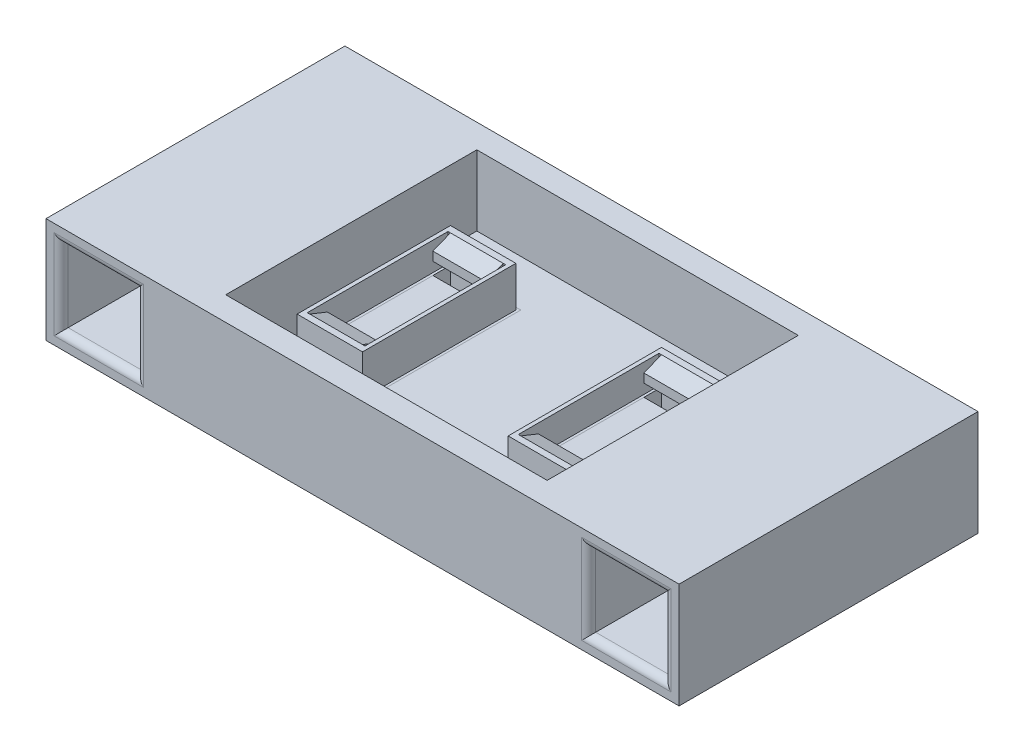
from build123d import *

# Parameters (mm, degrees)
SKETCH1_W            = 180
SKETCH1_H            = 85
BOSS_EXTRUDE1_DEPTH  = 30
SKETCH2_W            = 20
SKETCH2_H            = 20
CUT_EXTRUDE1_DEPTH   = 75
SKETCH3_W            = 90
SKETCH3_H            = 70
CUT_EXTRUDE2_DEPTH   = 20
SKETCH4_W            = 20
SKETCH4_H            = 45
BOSS_EXTRUDE2_DEPTH  = 20
SKETCH5_W            = 15
SKETCH5_H            = 40
CUT_EXTRUDE3_DEPTH   = 15
SKETCH6_W            = 51.650698135
SKETCH6_H            = 8.504884547
CUT_EXTRUDE4_DEPTH   = 82
BOSS_EXTRUDE3_DEPTH  = 77
SKETCH10_W           = 40
SKETCH10_H           = 40
CUT_EXTRUDE5_DEPTH   = 9
SKETCH16_W           = 15
SKETCH16_H           = 40
CUT_EXTRUDE6_DEPTH   = 1.5
SKETCH17_W           = 21.4
SKETCH17_H           = 21.4
CUT_EXTRUDE8_DEPTH   = 75
SKETCH18_W           = 91.4
SKETCH18_H           = 71.4
SKETCH18_W_2         = 90
SKETCH18_H_2         = 70
CUT_EXTRUDE10_DEPTH  = 50
SKETCH21_W           = 15
SKETCH21_H           = 5
CUT_EXTRUDE15_DEPTH  = 30
SKETCH25_W           = 0.696592811
SKETCH25_H           = 40.027797367
SKETCH25_W_2         = 0.703415494
SKETCH25_H_2         = 40
CUT_EXTRUDE18_DEPTH  = 8
SKETCH26_W           = 0.699157353
SKETCH26_H           = 40
SKETCH26_W_2         = 0.695462046
CUT_EXTRUDE19_DEPTH  = 8
SKETCH27_W           = 20
SKETCH27_H           = 45
SKETCH27_W_2         = 18.6
SKETCH27_H_2         = 43.6
CUT_EXTRUDE24_DEPTH  = 11.5
BOSS_EXTRUDE7_DEPTH  = 82
SKETCH32_W           = 21.4
SKETCH32_H           = 21.4
CUT_EXTRUDE26_DEPTH  = 65
SKETCH33_W           = 2.877376211
SKETCH33_H           = 11.527315039
CUT_EXTRUDE27_DEPTH  = 10
SKETCH34_W           = 3.240031444
SKETCH34_H           = 11.932327693
SKETCH34_W_2         = 3.815529698
SKETCH34_H_2         = 11.98992768
SKETCH34_W_3         = 5.074037473
CUT_EXTRUDE28_DEPTH  = 10
SKETCH35_W           = 2.001112191
SKETCH35_H           = 2.001112191
SKETCH35_H_2         = 3.01410829
SKETCH35_W_2         = 2.064409781
SKETCH35_H_3         = 2.859339239
SKETCH35_H_4         = 3.558014319
SKETCH35_W_3         = 2.166761366
CUT_EXTRUDE29_DEPTH  = 10
FILLET3_R            = 0.25
FILLET4_R            = 0.25
SKETCH37_W           = 21.4
SKETCH37_H           = 21.4
SKETCH37_W_2         = 20.4
SKETCH37_H_2         = 20.4
SKETCH37_W_3         = 0.2
SKETCH37_H_3         = 5.237775618
BOSS_EXTRUDE9_DEPTH  = 10
SKETCH38_W           = 21.4
SKETCH38_H           = 21.4
SKETCH38_W_2         = 20.4
SKETCH38_H_2         = 20.4
SKETCH38_W_3         = 0.2
SKETCH38_H_3         = 5.216967051
SKETCH38_H_4         = 5.237775618
BOSS_EXTRUDE10_DEPTH = 10
FILLET7_R            = 0.25
FILLET8_R            = 2


with BuildPart() as part:
    # Sketch1 → Boss-Extrude1 (new body)
    with BuildSketch(Plane(origin=(0, 0, 0), x_dir=(1, 0, 0), z_dir=(0, 1, 0))):
        with Locations((7.050691244, -8.801843318)):
            Rectangle(SKETCH1_W, SKETCH1_H)
    extrude(amount=BOSS_EXTRUDE1_DEPTH)

    # Sketch2 → Cut-Extrude1 (cut)
    with BuildSketch(Plane.XY.offset(51.301843318)):
        with Locations((-67.949308756, 15)):
            Rectangle(SKETCH2_W, SKETCH2_H)
        with Locations((82.050691244, 15)):
            Rectangle(SKETCH2_W, SKETCH2_H)
    extrude(amount=-CUT_EXTRUDE1_DEPTH, mode=Mode.SUBTRACT)

    # Sketch3 → Cut-Extrude2 (cut)
    with BuildSketch(Plane(origin=(0, 30, 0), x_dir=(1, 0, 0), z_dir=(0, 1, 0))):
        with Locations((7.050691244, -8.801843318)):
            Rectangle(SKETCH3_W, SKETCH3_H)
    extrude(amount=-CUT_EXTRUDE2_DEPTH, mode=Mode.SUBTRACT)

    # Sketch4 → Boss-Extrude2 (add)
    with BuildSketch(Plane(origin=(0, 10, 0), x_dir=(1, 0, 0), z_dir=(0, 1, 0))):
        with Locations((-22.949308756, -8.801843318)):
            Rectangle(SKETCH4_W, SKETCH4_H)
        with Locations((37.050691244, -8.801843318)):
            Rectangle(SKETCH4_W, SKETCH4_H)
    extrude(amount=BOSS_EXTRUDE2_DEPTH)

    # Sketch5 → Cut-Extrude3 (cut)
    with BuildSketch(Plane(origin=(0, 30, 0), x_dir=(1, 0, 0), z_dir=(0, 1, 0))):
        with Locations((-22.949308756, -8.801843318)):
            Rectangle(SKETCH5_W, SKETCH5_H)
        with Locations((37.050691244, -8.801843318)):
            Rectangle(SKETCH5_W, SKETCH5_H)
    extrude(amount=-CUT_EXTRUDE3_DEPTH, mode=Mode.SUBTRACT)

    # Sketch6 → Cut-Extrude4 (cut)
    with BuildSketch(Plane(origin=(47.050691244, 0, 0), x_dir=(0, 0, -1), z_dir=(1, 0, 0))):
        with Locations((-5.760534746, 25.747557727)):
            Rectangle(SKETCH6_W, SKETCH6_H)
    extrude(amount=-CUT_EXTRUDE4_DEPTH, mode=Mode.SUBTRACT)

    # Sketch7 → Boss-Extrude3 (add)
    with BuildSketch(Plane.ZY.offset(-44.550691244)):
        Polygon((-11.198156682, 21.495115453), (-6.198156682, 19.495115453), (-6.198156682, 16.995115453), (-11.198156682, 16.995115453), align=None)
        Polygon((28.801843318, 21.495115453), (28.801843318, 16.995115453), (23.801843318, 16.995115453), (23.801843318, 19.495115453), align=None)
    extrude(amount=BOSS_EXTRUDE3_DEPTH)

    # Sketch10 → Cut-Extrude5 (cut)
    with BuildSketch(Plane(origin=(0, 21.495115453, 0), x_dir=(1, 0, 0), z_dir=(0, 1, 0))):
        with Locations((7.050691244, -8.801843318)):
            Rectangle(SKETCH10_W, SKETCH10_H)
    extrude(amount=-CUT_EXTRUDE5_DEPTH, mode=Mode.SUBTRACT)

    # Sketch16 → Cut-Extrude6 (cut)
    with BuildSketch(Plane(origin=(0, 15, 0), x_dir=(1, 0, 0), z_dir=(0, 1, 0))):
        with Locations((-22.949308756, -8.801843318)):
            Rectangle(SKETCH16_W, SKETCH16_H)
        with Locations((37.050691244, -8.801843318)):
            Rectangle(SKETCH16_W, SKETCH16_H)
    extrude(amount=-CUT_EXTRUDE6_DEPTH, mode=Mode.SUBTRACT)

    # Sketch17 → Cut-Extrude8 (cut)
    with BuildSketch(Plane.XY.offset(51.301843318)):
        with Locations((-67.949308756, 15)):
            Rectangle(SKETCH17_W, SKETCH17_H)
        with Locations((82.050691244, 15)):
            Rectangle(SKETCH17_W, SKETCH17_H)
    extrude(amount=-CUT_EXTRUDE8_DEPTH, mode=Mode.SUBTRACT)

    # Sketch18 → Cut-Extrude10 (cut)
    with BuildSketch(Plane(origin=(0, 10, 0), x_dir=(1, 0, 0), z_dir=(0, 1, 0))):
        with Locations((7.050691244, -8.801843318)):
            Rectangle(SKETCH18_W, SKETCH18_H)
        with Locations((7.050691244, -8.801843318)):
            Rectangle(SKETCH18_W_2, SKETCH18_H_2, mode=Mode.SUBTRACT)
    extrude(amount=CUT_EXTRUDE10_DEPTH, mode=Mode.SUBTRACT)

    # Sketch21 → Cut-Extrude15 (cut)
    with BuildSketch(Plane(origin=(0, 13.5, 0), x_dir=(1, 0, 0), z_dir=(0, 1, 0))):
        with Locations((-22.949308756, 8.698156682)):
            Rectangle(SKETCH21_W, SKETCH21_H)
        with Locations((-22.949308756, -26.301843318)):
            Rectangle(SKETCH21_W, SKETCH21_H)
        with Locations((37.050691244, 8.698156682)):
            Rectangle(SKETCH21_W, SKETCH21_H)
        with Locations((37.050691244, -26.301843318)):
            Rectangle(SKETCH21_W, SKETCH21_H)
    extrude(amount=-CUT_EXTRUDE15_DEPTH, mode=Mode.SUBTRACT)

    # Sketch25 → Cut-Extrude18 (cut)
    with BuildSketch(Plane(origin=(0, 21.495115453, 0), x_dir=(1, 0, 0), z_dir=(0, 1, 0))):
        with Locations((-30.797605162, -8.815742002)):
            Rectangle(SKETCH25_W, SKETCH25_H)
        with Locations((-15.097601009, -8.801843318)):
            Rectangle(SKETCH25_W_2, SKETCH25_H_2)
    extrude(amount=-CUT_EXTRUDE18_DEPTH, mode=Mode.SUBTRACT)

    # Sketch26 → Cut-Extrude19 (cut)
    with BuildSketch(Plane(origin=(0, 21.495115453, 0), x_dir=(1, 0, 0), z_dir=(0, 1, 0))):
        with Locations((29.201112568, -8.801843318)):
            Rectangle(SKETCH26_W, SKETCH26_H)
        with Locations((44.898422267, -8.801843318)):
            Rectangle(SKETCH26_W_2, SKETCH26_H)
    extrude(amount=-CUT_EXTRUDE19_DEPTH, mode=Mode.SUBTRACT)

    # Sketch27 → Cut-Extrude24 (cut)
    # profile 1 of 2: a face of its own
    with BuildSketch(Plane(origin=(0, 21.495115453, 0), x_dir=(1, 0, 0), z_dir=(0, 1, 0))):
        with Locations((37.050691244, -8.801843318)):
            Rectangle(SKETCH27_W, SKETCH27_H)
        with Locations((37.050691244, -8.801843318)):
            Rectangle(SKETCH27_W_2, SKETCH27_H_2, mode=Mode.SUBTRACT)
    # profile 2 of 2: a face of its own
    with BuildSketch(Plane(origin=(0, 21.495115453, 0), x_dir=(1, 0, 0), z_dir=(0, 1, 0))):
        with Locations((-22.949308756, -8.801843318)):
            Rectangle(SKETCH27_W, SKETCH27_H)
        with Locations((-22.949308756, -8.801843318)):
            Rectangle(SKETCH27_W_2, SKETCH27_H_2, mode=Mode.SUBTRACT)
    extrude(amount=-CUT_EXTRUDE24_DEPTH, mode=Mode.SUBTRACT)

    # Sketch28 → Boss-Extrude7 (add)
    with BuildSketch(Plane.XY.offset(51.301843318)):
        Polygon((74.051803435, 12.381112191), (72.050691244, 10.38), (72.050691244, 19.62), (74.051803435, 17.618887809), (74.051803435, 20.298887809), (75.411803435, 20.298887809), (77.957387847, 17.753303397), (77.957387847, 12.246696603), (75.411803435, 9.701112191), (74.051803435, 9.701112191), align=None)
        Polygon((90.049579053, 12.381112191), (92.050691244, 10.38), (92.050691244, 19.62), (90.049579053, 17.618887809), (90.049579053, 20.298887809), (88.689579053, 20.298887809), (86.143994641, 17.753303397), (86.143994641, 12.246696603), (88.689579053, 9.701112191), (90.049579053, 9.701112191), align=None)
        Polygon((-75.948196565, 17.618887809), (-77.949308756, 19.62), (-77.949308756, 10.38), (-75.948196565, 12.381112191), (-75.948196565, 9.701112191), (-74.588196565, 9.701112191), (-72.042612153, 12.246696603), (-72.042612153, 17.753303397), (-74.588196565, 20.298887809), (-75.948196565, 20.298887809), align=None)
        Polygon((-57.949308756, 10.38), (-57.949308756, 19.62), (-59.950420947, 17.618887809), (-59.950420947, 20.298887809), (-61.310420947, 20.298887809), (-63.856005359, 17.753303397), (-63.856005359, 12.246696603), (-61.310420947, 9.701112191), (-59.950420947, 9.701112191), (-59.950420947, 12.381112191), align=None)
    extrude(amount=-BOSS_EXTRUDE7_DEPTH)

    # Sketch32 → Cut-Extrude26 (cut)
    with BuildSketch(Plane.XY.offset(51.301843318)):
        with Locations((-67.949308756, 15)):
            Rectangle(SKETCH32_W, SKETCH32_H)
        with Locations((82.050691244, 15)):
            Rectangle(SKETCH32_W, SKETCH32_H)
    extrude(amount=-CUT_EXTRUDE26_DEPTH, mode=Mode.SUBTRACT)

    # Sketch33 → Cut-Extrude27 (cut)
    with BuildSketch(Plane.XY.offset(-13.698156682)):
        with Locations((76.850491541, 14.535230289)):
            Rectangle(SKETCH33_W, SKETCH33_H)
    extrude(amount=-CUT_EXTRUDE27_DEPTH, mode=Mode.SUBTRACT)

    # Sketch34 → Cut-Extrude28 (cut)
    with BuildSketch(Plane.XY.offset(-13.698156682)):
        with Locations((87.069563331, 14.332723963)):
            Rectangle(SKETCH34_W, SKETCH34_H)
        with Locations((-72.680431716, 15.696076031)):
            Rectangle(SKETCH34_W_2, SKETCH34_H_2)
        with Locations((-63.847439683, 14.332723963)):
            Rectangle(SKETCH34_W_3, SKETCH34_H)
    extrude(amount=-CUT_EXTRUDE28_DEPTH, mode=Mode.SUBTRACT)

    # Sketch35 → Cut-Extrude29 (cut)
    with BuildSketch(Plane.XY.offset(-13.698156682)):
        with Locations((-76.948752661, 18.619443905)):
            Rectangle(SKETCH35_W, SKETCH35_H)
        with Locations((-76.948752661, 10.874058046)):
            Rectangle(SKETCH35_W, SKETCH35_H_2)
        with Locations((-58.918216057, 19.048557429)):
            Rectangle(SKETCH35_W_2, SKETCH35_H_3)
        with Locations((-58.918216057, 10.602105032)):
            Rectangle(SKETCH35_W_2, SKETCH35_H_4)
        with Locations((73.05124734, 18.619443905)):
            Rectangle(SKETCH35_W, SKETCH35_H)
        with Locations((73.05124734, 10.874058046)):
            Rectangle(SKETCH35_W, SKETCH35_H_2)
        with Locations((91.132959736, 10.602105032)):
            Rectangle(SKETCH35_W_3, SKETCH35_H_4)
        with Locations((91.132959736, 19.048557429)):
            Rectangle(SKETCH35_W_3, SKETCH35_H_3)
    extrude(amount=-CUT_EXTRUDE29_DEPTH, mode=Mode.SUBTRACT)

    # Fillet3
    fillet3_edges = [part.edges().sort_by_distance(p)[0] for p in [
        (72.050691244, 15, -13.698156682),
        (73.05124734, 17.618887809, -13.698156682),
        (73.05124734, 12.381112191, -13.698156682),
        (74.051803435, 11.041112191, -13.698156682),
        (74.731803435, 9.701112191, -13.698156682),
        (74.731803435, 20.298887809, -13.698156682),
        (74.051803435, 18.958887809, -13.698156682),
        (75.411803435, 15, -13.698156682),
    ]]
    fillet(fillet3_edges, radius=FILLET3_R)

    # Fillet4
    fillet4_edges = [part.edges().sort_by_distance(p)[0] for p in [
        (-61.310420947, 15, -13.698156682),
        (88.689579053, 15, -13.698156682),
        (-57.949308756, 15, -13.698156682),
        (-77.949308756, 15, -13.698156682),
        (92.050691244, 15, -13.698156682),
        (-58.949864851, 12.381112191, -13.698156682),
        (-58.949864851, 17.618887809, -13.698156682),
        (-76.94875266, 12.381112191, -13.698156682),
        (91.050135149, 12.381112191, -13.698156682),
        (91.050135149, 17.618887809, -13.698156682),
        (-76.94875266, 17.618887809, -13.698156682),
        (-59.950420947, 11.041112191, -13.698156682),
        (-60.630420947, 9.701112191, -13.698156682),
        (-60.630420947, 20.298887809, -13.698156682),
        (-59.950420947, 18.958887809, -13.698156682),
        (-75.948196565, 11.041112191, -13.698156682),
        (-75.268196565, 9.701112191, -13.698156682),
        (-75.268196565, 20.298887809, -13.698156682),
        (-75.948196565, 18.958887809, -13.698156682),
        (90.049579053, 11.041112191, -13.698156682),
        (89.369579053, 9.701112191, -13.698156682),
        (89.369579053, 20.298887809, -13.698156682),
        (90.049579053, 18.958887809, -13.698156682),
        (-74.588196565, 15, -13.698156682),
    ]]
    fillet(fillet4_edges, radius=FILLET4_R)

    # Sketch37 → Boss-Extrude9 (add)
    # profile 1 of 3: a face of its own
    with BuildSketch(Plane.XY.offset(-23.698156682)):
        with Locations((-67.949308756, 15)):
            Rectangle(SKETCH37_W, SKETCH37_H)
        with Locations((-67.949308756, 15)):
            Rectangle(SKETCH37_W_2, SKETCH37_H_2, mode=Mode.SUBTRACT)
    # profile 2 of 3: a face of its own
    with BuildSketch(Plane.XY.offset(-23.698156682)):
        with Locations((-57.849308756, 15)):
            Rectangle(SKETCH37_W_3, SKETCH37_H_3)
    # profile 3 of 3: a face of its own
    with BuildSketch(Plane.XY.offset(-23.698156682)):
        with Locations((-78.049308756, 15)):
            Rectangle(SKETCH37_W_3, SKETCH37_H_3)
    extrude(amount=BOSS_EXTRUDE9_DEPTH)

    # Sketch38 → Boss-Extrude10 (add)
    # profile 1 of 3: a face of its own
    with BuildSketch(Plane.XY.offset(-23.698156682)):
        with Locations((82.050691244, 15)):
            Rectangle(SKETCH38_W, SKETCH38_H)
        with Locations((82.050691244, 15)):
            Rectangle(SKETCH38_W_2, SKETCH38_H_2, mode=Mode.SUBTRACT)
    # profile 2 of 3: a face of its own
    with BuildSketch(Plane.XY.offset(-23.698156682)):
        with Locations((71.950691244, 14.989595717)):
            Rectangle(SKETCH38_W_3, SKETCH38_H_3)
    # profile 3 of 3: a face of its own
    with BuildSketch(Plane.XY.offset(-23.698156682)):
        with Locations((92.150691244, 15)):
            Rectangle(SKETCH38_W_3, SKETCH38_H_4)
    extrude(amount=BOSS_EXTRUDE10_DEPTH)

    # Fillet7
    fillet7_edges = [part.edges().sort_by_distance(p)[0] for p in [
        (71.350691244, 15, -13.698156682),
        (82.050691244, 25.7, -13.698156682),
        (92.750691244, 15, -13.698156682),
        (82.050691244, 4.3, -13.698156682),
        (92.150691244, 12.381112191, -13.698156682),
        (92.050691244, 15, -13.698156682),
        (92.150691244, 17.618887809, -13.698156682),
        (92.250691244, 8.590556095, -13.698156682),
        (82.050691244, 25.2, -13.698156682),
        (71.850691244, 8.590556095, -13.698156682),
        (71.950691244, 17.598079242, -13.698156682),
        (72.050691244, 14.989595716, -13.698156682),
        (71.950691244, 12.381112191, -13.698156682),
        (71.850691244, 21.399039621, -13.698156682),
        (82.050691244, 4.8, -13.698156682),
        (92.250691244, 21.409443905, -13.698156682),
        (-78.149308756, 21.409443905, -13.698156682),
        (-78.049308756, 17.618887809, -13.698156682),
        (-77.949308756, 15, -13.698156682),
        (-78.049308756, 12.381112191, -13.698156682),
        (-78.149308756, 8.590556095, -13.698156682),
        (-67.949308756, 4.8, -13.698156682),
        (-57.749308756, 21.409443905, -13.698156682),
        (-57.849308756, 12.381112191, -13.698156682),
        (-57.949308756, 15, -13.698156682),
        (-57.849308756, 17.618887809, -13.698156682),
        (-57.749308756, 8.590556095, -13.698156682),
        (-67.949308756, 25.2, -13.698156682),
        (-78.649308756, 15, -13.698156682),
        (-67.949308756, 25.7, -13.698156682),
        (-57.249308756, 15, -13.698156682),
        (-67.949308756, 4.3, -13.698156682),
    ]]
    fillet(fillet7_edges, radius=FILLET7_R - 0.0001)  # a hair under: the kernel refuses the full size

    # Fillet8
    fillet8_edges = [part.edges().sort_by_distance(p)[0] for p in [
        (-57.249308756, 15, 51.301843318),
        (-67.949308756, 25.7, 51.301843318),
        (-78.649308756, 15, 51.301843318),
        (-67.949308756, 4.3, 51.301843318),
        (92.750691244, 15, 51.301843318),
        (82.050691244, 25.7, 51.301843318),
        (71.350691244, 15, 51.301843318),
        (82.050691244, 4.3, 51.301843318),
    ]]
    fillet(fillet8_edges, radius=FILLET8_R)


solid = part.part
